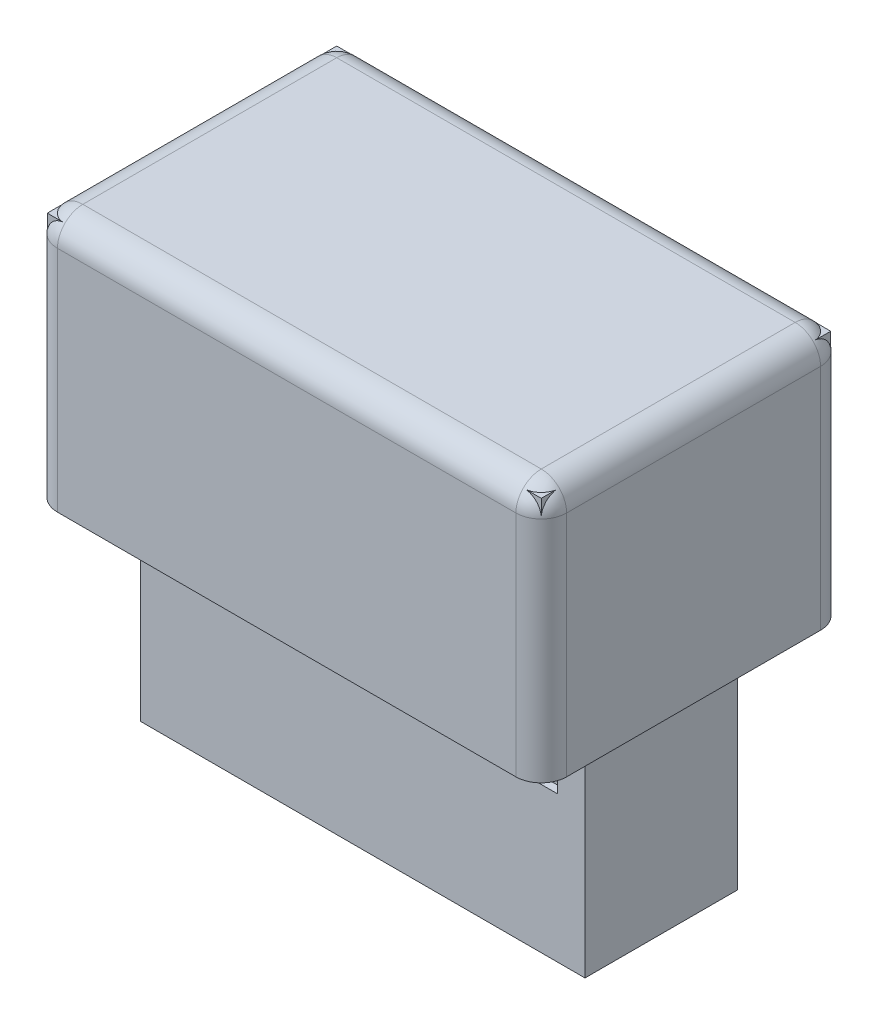
from build123d import *

# Parameters (mm, degrees)
SKETCH1_W                      = 40.11
SKETCH1_H                      = 20
BOSS_EXTRUDE1_DEPTH            = 12
SKETCH2_W                      = 35
SKETCH2_H                      = 17
BOSS_EXTRUDE2_DEPTH            = 6
SHELL1_START                   = 3.155
SHELL1_DEPTH                   = 33.8
SHELL1_START_2                 = 0.6
SHELL1_2_OUTLINE_W             = 18.8
SHELL1_2_OUTLINE_H             = 22.8
SHELL1_2_DEPTH                 = 38.91
SHELL1_START_3                 = -3.9
SHELL1_3_OUTLINE_R             = 0.1
SHELL1_3_DEPTH                 = 4.5
CUT_EXTRUDE1_REACH             = 48.398
SKETCH4_W                      = 30.63
SKETCH4_H                      = 5.52
CUT_EXTRUDE1_DIRECTION_2_REACH = 48.398
BOSS_EXTRUDE3_START            = 9.13
SKETCH5_W                      = 10.98
SKETCH5_H                      = 24.92
BOSS_EXTRUDE3_DEPTH            = 1.74
FILLET1_R                      = 2


# Read off the part's stored shape, not the designer's step: Shell1
with BuildPart() as part:
    # Sketch1 → Boss-Extrude1 (new, symmetric)
    with BuildSketch(Plane.XY):
        with Locations((20.055, 10)):
            Rectangle(SKETCH1_W, SKETCH1_H)
    extrude(amount=BOSS_EXTRUDE1_DEPTH, both=True)

    # Sketch2 → Boss-Extrude2 (add, symmetric)
    with BuildSketch(Plane.XY):
        with Locations((20.055, -8.5)):
            Rectangle(SKETCH2_W, SKETCH2_H)
    extrude(amount=BOSS_EXTRUDE2_DEPTH, both=True)

    # Sketch3 → Revolve1 (revolve)
    with BuildSketch(Plane.XY, mode=Mode.PRIVATE) as revolve1_sk:
        with BuildLine():
            Line((0, 0), (-3.5, 0))
            Line((-3.5, 0), (-3.5, -0.45))
            Line((-3.5, -0.45), (-4, -0.45))
            ThreePointArc((-4, -0.45), (-4.353553391, -0.303553391), (-4.5, 0.05))
            Line((-4.5, 0.05), (-4.5, 0.7))
            Line((-4.5, 0.7), (0, 0.7))
            Line((0, 0.7), (0, 0))
        make_face()
    revolve(revolve1_sk.sketch.rotate(Axis((0, 0.7, 0), (-1, 0, 0)), 180), axis=Axis((0, 0.7, 0), (-1, 0, 0)))

    # Shell1 outline → Shell1 (cut)
    with BuildSketch(Plane.YZ.offset(SHELL1_START)):
        Polygon((0.6, -5.4), (0.6, -11.4), (19.4, -11.4), (19.4, 11.4), (0.6, 11.4), (0.6, 5.4), (-17, 5.4), (-17, -5.4), align=None)
    extrude(amount=SHELL1_DEPTH, mode=Mode.SUBTRACT)

    # Shell1 2 outline → Shell1 2 (cut)
    with BuildSketch(Plane.YZ.offset(SHELL1_START_2)):
        with Locations((10, 0)):
            Rectangle(SHELL1_2_OUTLINE_W, SHELL1_2_OUTLINE_H)
    extrude(amount=SHELL1_2_DEPTH, mode=Mode.SUBTRACT)

    # Shell1 3 outline → Shell1 3 (cut)
    with BuildSketch(Plane.YZ.offset(SHELL1_START_3)):
        with Locations((0.7, 0)):
            Circle(SHELL1_3_OUTLINE_R)
    extrude(amount=SHELL1_3_DEPTH, mode=Mode.SUBTRACT)

    # Sketch4 → Cut-Extrude1 (cut, up to next)
    with BuildSketch(Plane.XY, mode=Mode.PRIVATE) as cut_extrude1_sk1:
        with Locations((20.055, -2.76)):
            Rectangle(SKETCH4_W, SKETCH4_H)
    cut_extrude1_tool1 = extrude(cut_extrude1_sk1.sketch, amount=-CUT_EXTRUDE1_REACH, mode=Mode.PRIVATE) & part.part
    add(cut_extrude1_tool1.solids().sort_by_distance((20.055, -2.76, 0))[0], mode=Mode.SUBTRACT)

    # Sketch4 → Cut-Extrude1 direction 2 (cut, up to next)
    with BuildSketch(Plane.XY, mode=Mode.PRIVATE) as cut_extrude1_direction_2_sk1:
        with Locations((20.055, -2.76)):
            Rectangle(SKETCH4_W, SKETCH4_H)
    cut_extrude1_direction_2_tool1 = extrude(cut_extrude1_direction_2_sk1.sketch, amount=CUT_EXTRUDE1_DIRECTION_2_REACH, mode=Mode.PRIVATE) & part.part
    add(cut_extrude1_direction_2_tool1.solids().sort_by_distance((20.055, -2.76, 0))[0], mode=Mode.SUBTRACT)

    # Sketch5 → Boss-Extrude3 (add)
    with BuildSketch(Plane.ZY.offset(-20.055).offset(BOSS_EXTRUDE3_START)):
        with Locations((0, 6.94)):
            Rectangle(SKETCH5_W, SKETCH5_H)
    boss_extrude3 = extrude(amount=BOSS_EXTRUDE3_DEPTH)

    # Mirror1: Boss-Extrude3 across plane
    add(boss_extrude3.mirror(Plane.ZY.offset(-20.055)))

    # Fillet1
    fillet1_edges = [part.edges().sort_by_distance(p)[0] for p in [
        (40.11, 10, 12),
        (20.055, 20, 12),
        (0, 10, 12),
        (20.055, 20, -12),
        (40.11, 10, -12),
        (0, 10, -12),
        (0, 20, 0),
        (40.11, 20, 0),
    ]]
    fillet(fillet1_edges, radius=FILLET1_R)


solid = part.part
